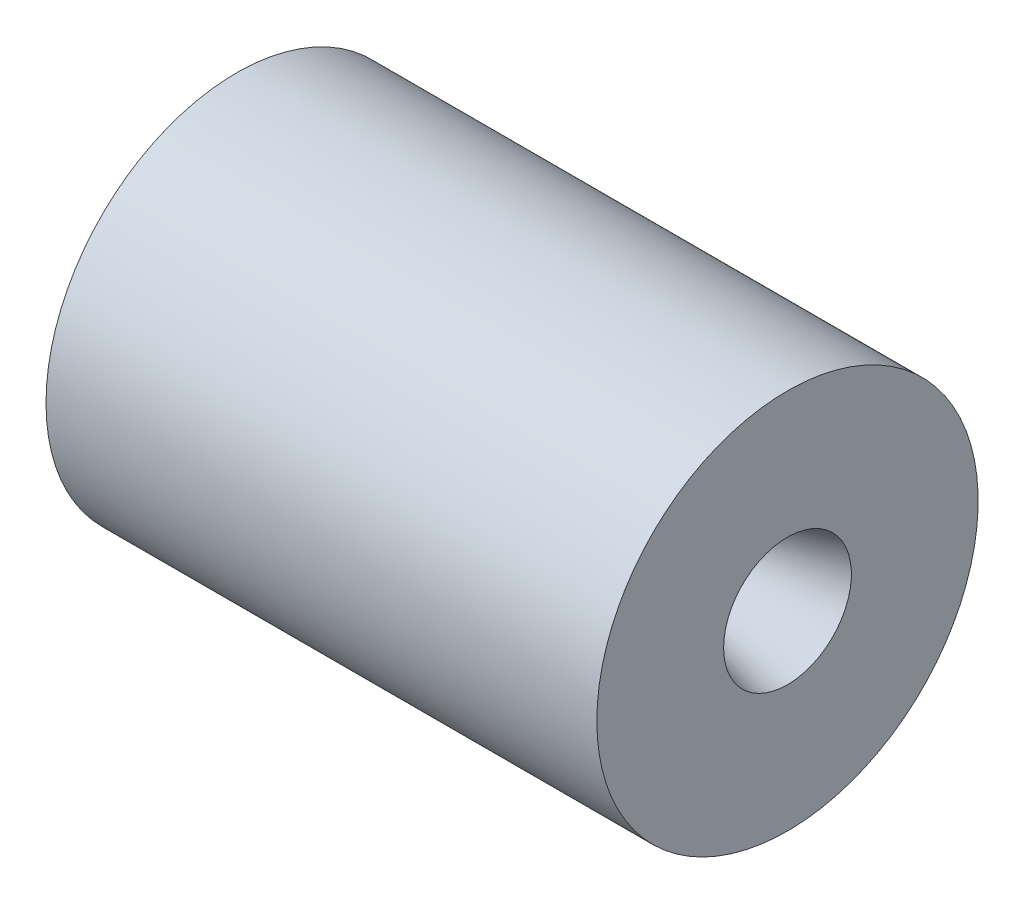
from build123d import *


with BuildPart() as part:
    # Sketch1 → Revolve1 (revolve)
    with BuildSketch(Plane.XY):
        with BuildLine():
            Line((-51.621982608, 22.225), (-18.04987583, 22.225))
            ThreePointArc((-18.04987583, 22.225), (-14.242726088, 21.23177166), (-11.406001811, 18.505256106))
            Line((-11.406001811, 18.505256106), (-3.252609178, 5.207))
            ThreePointArc((-3.252609178, 5.207), (-1.864350685, 3.862323193), (0, 3.3528))
            ThreePointArc((0, 3.3528), (0.414397805, 3.375109045), (0.821750452, 3.4544))
            Line((0.821750452, 3.4544), (18.164755136, 8.095448376))
            Line((18.164755136, 8.095448376), (18.164755136, 24.1554))
            Line((18.164755136, 24.1554), (-51.621982608, 24.1554))
            Line((-51.621982608, 24.1554), (-51.621982608, 22.225))
        make_face()
    revolve(axis=Axis((-50.899256216, 0, 0), (1, 0, 0)))


solid = part.part
